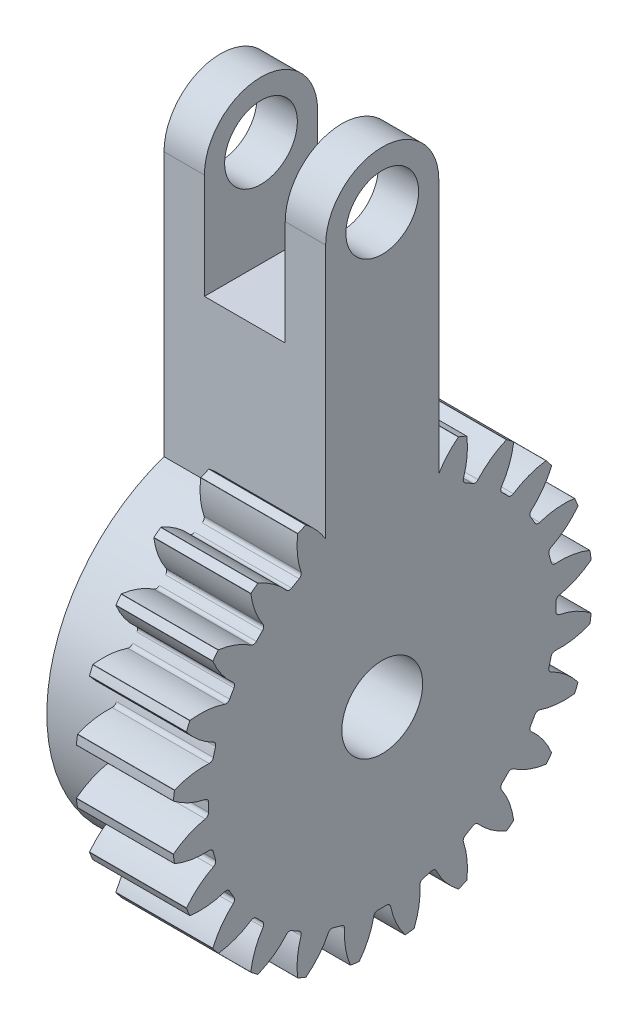
from build123d import *
from build123d.topology import SkipClean

# Parameters (mm, degrees)
BASPROSKE_W                = 6
BASPROSKE_H                = 13
TOOTHCUT_DEPTH             = 20.339079606
BREAKS_R                   = 0.02
ROOTFILLETS_R              = 0.251
TEETHCUTS_COUNT            = 24
BREAKS_OF_TEETHCUTS_R      = 0.02
ROOTFILLETS_OF_TEETHCUTS_R = 0.251
HUBNEARONE_START           = 4
HUBNEAONESKE_R             = 10.749
HUBNEARONE_DEPTH           = 4
HUBNEARBOTH_START          = 4
HUBNEABOTSKE_R             = 10.749
HUBNEARBOTH_DEPTH          = 4
BORSKE_R                   = 2.5
BORE_DEPTH                 = 50.00127
SKETCH_1_R                 = 9
EXTRUDE_1_DEPTH            = 4
SKETCH_2_R                 = 2.5
CUT_EXTRUDE_1_DEPTH        = 21.83012979
EXTRUDE_2_DEPTH            = 6
EXTRUDE_2_DEPTH_BACK       = 4
CUT_EXTRUDE_2_DEPTH        = 34.210648288
CUT_EXTRUDE_2_DEPTH_BACK   = 34.210648288
SKETCH_4_W                 = 5
SKETCH_4_H                 = 12
HOLE_WIZARD_M41_D          = 4.5
HOLE_WIZARD_M41_DEPTH      = 15
HOLE_WIZARD_M41_TIP        = 1.351936393


with BuildPart() as part:
    # BasProSke → Base-Revolve (revolve)
    with BuildSketch(Plane(origin=(0, 0, 0), x_dir=(1, 0, 0), z_dir=(0, 1, 0))):
        with Locations((3, 6.5)):
            Rectangle(BASPROSKE_W, BASPROSKE_H)
    revolve(axis=Axis((-10, 0, 0), (1, 0, 0)))

    # TooCutSke → ToothCut (cut, through all)
    with BuildSketch(Plane(origin=(0, 0, 0), x_dir=(0, 0, -1), z_dir=(1, 0, 0))):
        with BuildLine():
            ThreePointArc((0.483448384, 10.738122679), (0, 10.749), (-0.483448384, 10.738122679))
            ThreePointArc((-0.483448384, 10.738122679), (-0.821636462, 11.902754369), (-1.44092227, 12.945454344))
            ThreePointArc((-1.44092227, 12.945454344), (0, 13.0254), (1.44092227, 12.945454344))
            ThreePointArc((1.44092227, 12.945454344), (0.821636462, 11.902754369), (0.483448384, 10.738122679))
        make_face()
    toothcut = extrude(amount=TOOTHCUT_DEPTH, mode=Mode.SUBTRACT)

    # Breaks
    breaks_edges = [part.edges().sort_by_distance(p)[0] for p in [
        (3, 12.921919179, -1.422675204),
        (3, 12.921919179, 1.422675204),
    ]]
    fillet(breaks_edges, radius=BREAKS_R)

    # RootFillets
    rootfillets_edges = [part.edges().sort_by_distance(p)[0] for p in [
        (3, 10.738122679, -0.483448384),
        (3, 10.738122679, 0.483448384),
    ]]
    fillet(rootfillets_edges, radius=ROOTFILLETS_R)

    # TeethCuts: ToothCut ×24 about axis
    teethcuts_axis = Axis((-10, 0, 0), (1, 0, 0))
    for i in range(1, TEETHCUTS_COUNT):
        add(toothcut.rotate(teethcuts_axis, i * 360 / TEETHCUTS_COUNT), mode=Mode.SUBTRACT)

    # Breaks of TeethCuts
    breaks_of_teethcuts_edges = [part.edges().sort_by_distance(p)[0] for p in [
        (3, 12.849830898, 1.970240061),
        (3, 12.113400022, 4.718637505),
        (3, 11.902047876, 5.228886722),
        (3, 10.479372673, 7.693032457),
        (3, 10.143159961, 8.131193393),
        (3, 8.131193393, 10.143159961),
        (3, 7.693032457, 10.479372673),
        (3, 5.228886722, 11.902047876),
        (3, 4.718637505, 12.113400022),
        (3, 1.970240061, 12.849830898),
        (3, 1.422675204, 12.921919179),
        (3, -1.422675204, 12.921919179),
        (3, -1.970240061, 12.849830898),
        (3, -4.718637505, 12.113400022),
        (3, -5.228886722, 11.902047876),
        (3, -7.693032457, 10.479372673),
        (3, -8.131193393, 10.143159961),
        (3, -10.143159961, 8.131193393),
        (3, -10.479372673, 7.693032457),
        (3, -11.902047876, 5.228886722),
        (3, -12.113400022, 4.718637505),
        (3, -12.849830898, 1.970240061),
        (3, -12.921919179, 1.422675204),
        (3, -12.921919179, -1.422675204),
        (3, -12.849830898, -1.970240061),
        (3, -12.113400022, -4.718637505),
        (3, -11.902047876, -5.228886722),
        (3, -10.479372673, -7.693032457),
        (3, -10.143159961, -8.131193393),
        (3, -8.131193393, -10.143159961),
        (3, -7.693032457, -10.479372673),
        (3, -5.228886722, -11.902047876),
        (3, -4.718637505, -12.113400022),
        (3, -1.970240061, -12.849830898),
        (3, -1.422675204, -12.921919179),
        (3, 1.422675204, -12.921919179),
        (3, 1.970240061, -12.849830898),
        (3, 4.718637505, -12.113400022),
        (3, 5.228886722, -11.902047876),
        (3, 7.693032457, -10.479372673),
        (3, 8.131193393, -10.143159961),
        (3, 10.143159961, -8.131193393),
        (3, 10.479372673, -7.693032457),
        (3, 11.902047876, -5.228886722),
        (3, 12.113400022, -4.718637505),
        (3, 12.849830898, -1.970240061),
    ]]
    fillet(breaks_of_teethcuts_edges, radius=BREAKS_OF_TEETHCUTS_R)

    # RootFillets of TeethCuts
    rootfillets_of_teethcuts_edges = [part.edges().sort_by_distance(p)[0] for p in [
        (3, 10.49735567, 2.312255378),
        (3, 10.247104372, 3.246205938),
        (3, 9.541211221, 4.950382757),
        (3, 9.057762836, 5.787739922),
        (3, 7.934848994, 7.251149732),
        (3, 7.251149732, 7.934848994),
        (3, 5.787739922, 9.057762836),
        (3, 4.950382757, 9.541211221),
        (3, 3.246205938, 10.247104372),
        (3, 2.312255378, 10.49735567),
        (3, 0.483448384, 10.738122679),
        (3, -0.483448384, 10.738122679),
        (3, -2.312255378, 10.49735567),
        (3, -3.246205938, 10.247104372),
        (3, -4.950382757, 9.541211221),
        (3, -5.787739922, 9.057762836),
        (3, -7.251149732, 7.934848994),
        (3, -7.934848994, 7.251149732),
        (3, -9.057762836, 5.787739922),
        (3, -9.541211221, 4.950382757),
        (3, -10.247104372, 3.246205938),
        (3, -10.49735567, 2.312255378),
        (3, -10.738122679, 0.483448384),
        (3, -10.738122679, -0.483448384),
        (3, -10.49735567, -2.312255378),
        (3, -10.247104372, -3.246205938),
        (3, -9.541211221, -4.950382757),
        (3, -9.057762836, -5.787739922),
        (3, -7.934848994, -7.251149732),
        (3, -7.251149732, -7.934848994),
        (3, -5.787739922, -9.057762836),
        (3, -4.950382757, -9.541211221),
        (3, -3.246205938, -10.247104372),
        (3, -2.312255378, -10.49735567),
        (3, -0.483448384, -10.738122679),
        (3, 0.483448384, -10.738122679),
        (3, 2.312255378, -10.49735567),
        (3, 3.246205938, -10.247104372),
        (3, 4.950382757, -9.541211221),
        (3, 5.787739922, -9.057762836),
        (3, 7.251149732, -7.934848994),
        (3, 7.934848994, -7.251149732),
        (3, 9.057762836, -5.787739922),
        (3, 9.541211221, -4.950382757),
        (3, 10.247104372, -3.246205938),
        (3, 10.49735567, -2.312255378),
    ]]
    fillet(rootfillets_of_teethcuts_edges, radius=ROOTFILLETS_OF_TEETHCUTS_R)

    # HubNeaOneSke → HubNearOne (add)
    with SkipClean():  # the faces are left unmerged after this step: merging them gives an invalid solid
        with BuildSketch(Plane.ZY.offset(HUBNEARONE_START)):
            Circle(HUBNEAONESKE_R)
        extrude(amount=-HUBNEARONE_DEPTH)

    # HubNeaBotSke → HubNearBoth (add)
    with SkipClean():  # the faces are left unmerged after this step: merging them gives an invalid solid
        with BuildSketch(Plane.ZY.offset(HUBNEARBOTH_START)):
            Circle(HUBNEABOTSKE_R)
        extrude(amount=-HUBNEARBOTH_DEPTH)

    # BorSke → Bore (cut, symmetric)
    with SkipClean():  # the faces are left unmerged after this step: merging them gives an invalid solid
        with BuildSketch(Plane(origin=(0, 0, 0), x_dir=(0, 0, -1), z_dir=(1, 0, 0))):
            Circle(BORSKE_R)
        extrude(amount=BORE_DEPTH, both=True, mode=Mode.SUBTRACT)

    # Эскиз1 → Бобышка-Вытянуть1 (add)
    with SkipClean():  # the faces are left unmerged after this step: merging them gives an invalid solid
        with BuildSketch(Plane.ZY):
            Circle(SKETCH_1_R)
        extrude(amount=EXTRUDE_1_DEPTH)

    # Эскиз2 → Вырез-Вытянуть1 (cut, through all)
    with SkipClean():  # the faces are left unmerged after this step: merging them gives an invalid solid
        with BuildSketch(Plane.ZY.offset(4)):
            Circle(SKETCH_2_R)
        extrude(amount=-CUT_EXTRUDE_1_DEPTH, mode=Mode.SUBTRACT)

    # Эскиз3 → Бобышка-Вытянуть2 (add, two sides: drawn at the far end of the back side and taken through both)
    with BuildSketch(Plane(origin=(0, 0, 0), x_dir=(0, 0, -1), z_dir=(1, 0, 0)).offset(-EXTRUDE_2_DEPTH_BACK)):
        with BuildLine():
            Line((-3.5, 26.5), (-3.5, 7))
            Line((-3.5, 7), (3.5, 7))
            Line((3.5, 7), (3.5, 26.5))
            ThreePointArc((3.5, 26.5), (0, 30), (-3.5, 26.5))
        make_face()
    extrude(amount=EXTRUDE_2_DEPTH + EXTRUDE_2_DEPTH_BACK)

    # Эскиз4 → Вырез-Вытянуть2 (cut, two sides: drawn at the far end of the back side and taken through both)
    with BuildSketch(Plane.XY.offset(-CUT_EXTRUDE_2_DEPTH_BACK)):
        with Locations((1, 26)):
            Rectangle(SKETCH_4_W, SKETCH_4_H)
    extrude(amount=CUT_EXTRUDE_2_DEPTH + CUT_EXTRUDE_2_DEPTH_BACK, mode=Mode.SUBTRACT)

    # Отверстие с зазором M41
    with Locations(Plane(origin=(6, 0, 0), x_dir=(0, 0, -1), z_dir=(1, 0, 0))):
        with Locations((0, 26.5)):
            Hole(HOLE_WIZARD_M41_D / 2, depth=HOLE_WIZARD_M41_DEPTH)
            with Locations((0, 0, -(HOLE_WIZARD_M41_DEPTH + HOLE_WIZARD_M41_TIP / 2))):  # 118° drill point
                Cone(0, HOLE_WIZARD_M41_D / 2, HOLE_WIZARD_M41_TIP, mode=Mode.SUBTRACT)


solid = part.part
